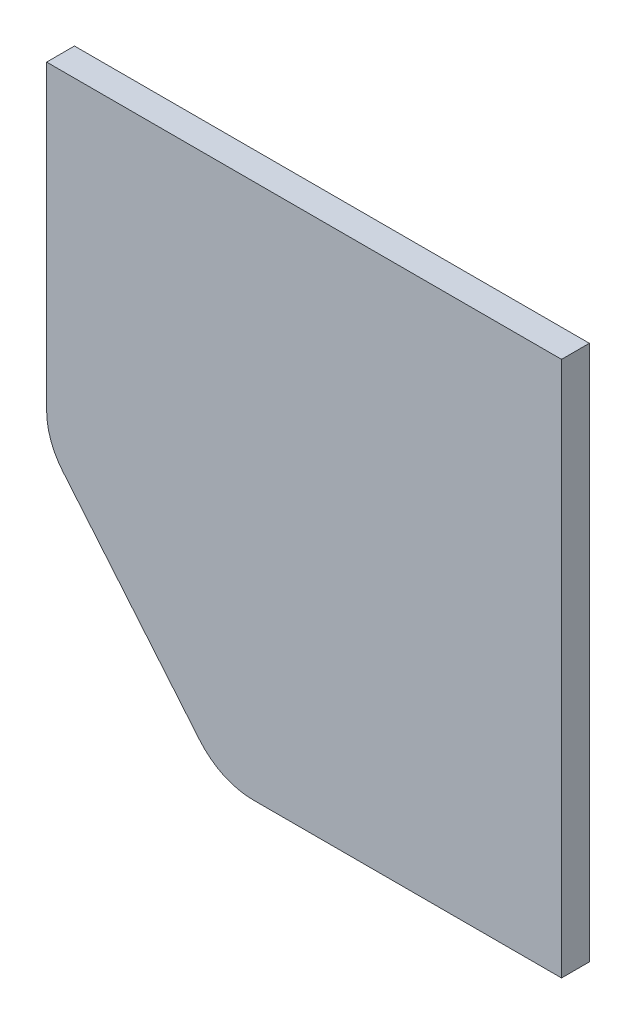
from build123d import *

# Parameters (mm, degrees)
ESBO_O1_W                  = 74
ESBO_O1_H                  = 77
RESSALTO_EXTRUS_O1_DEPTH   = 4
CORTE_EXTRUS_O2_DEPTH      = 97.844420883
CORTE_EXTRUS_O2_DEPTH_BACK = 97.844420883
FILETE2_R                  = 10
FILETE3_R                  = 10


with BuildPart() as part:
    # Esboço1 → Ressalto-extrusão1 (new body)
    with BuildSketch(Plane.XY):
        with Locations((-49.165685596, 5.526315789)):
            Rectangle(ESBO_O1_W, ESBO_O1_H)
    extrude(amount=RESSALTO_EXTRUS_O1_DEPTH)

    # Esboço4 → Corte-extrusão2 (cut, two sides: drawn at the far end of the back side and taken through both)
    with BuildSketch(Plane.XY.offset(4).offset(-CORTE_EXTRUS_O2_DEPTH_BACK)):
        Polygon((62.093925387, -180.88521739), (-61.165685596, -32.973684211), (-86.165685596, -2.973684211), (-209.425296578, 144.937848968), (-505.248362936, -101.581372997), (-233.729140971, -427.404439354), align=None)
    extrude(amount=CORTE_EXTRUS_O2_DEPTH + CORTE_EXTRUS_O2_DEPTH_BACK, mode=Mode.SUBTRACT)

    # Filete2
    filete2_edges = [part.edges().sort_by_distance(p)[0] for p in [
        (-86.165685596, -2.973684211, 2),
    ]]
    fillet(filete2_edges, radius=FILETE2_R)

    # Filete3
    filete3_edges = [part.edges().sort_by_distance(p)[0] for p in [
        (-61.165685596, -32.973684211, 2),
    ]]
    fillet(filete3_edges, radius=FILETE3_R)


solid = part.part
